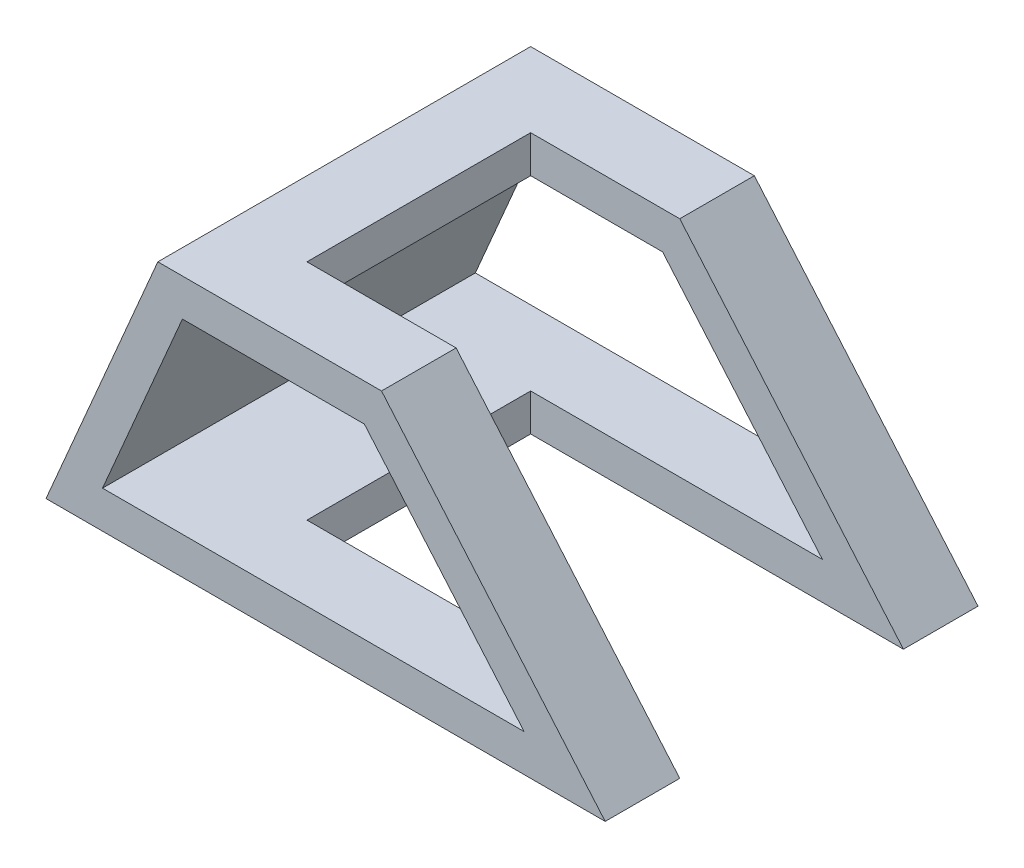
from build123d import *

# Parameters (mm, degrees)
BOSS_EXTRU_1_DEPTH      = 100
ESQUISSE2_W             = 100
ESQUISSE2_H             = 60
ENL_V_MAT_EXTRU_1_DEPTH = 171


with BuildPart() as part:
    # Esquisse1 → Boss.-Extru.1 (new body)
    with BuildSketch(Plane.XY):
        Polygon((0, 0), (30, 70), (90, 70), (150, 0), align=None)
        Polygon((36.59396158, 60), (85.400650775, 60), (128.257793632, 10), (15.165390151, 10), align=None, mode=Mode.SUBTRACT)
    extrude(amount=BOSS_EXTRU_1_DEPTH)

    # Esquisse2 → Enlèv. mat.-Extru.1 (cut)
    with BuildSketch(Plane(origin=(0, 70, 0), x_dir=(1, 0, 0), z_dir=(0, 1, 0))):
        with Locations((100, -50)):
            Rectangle(ESQUISSE2_W, ESQUISSE2_H)
    extrude(amount=-ENL_V_MAT_EXTRU_1_DEPTH, mode=Mode.SUBTRACT)


solid = part.part
